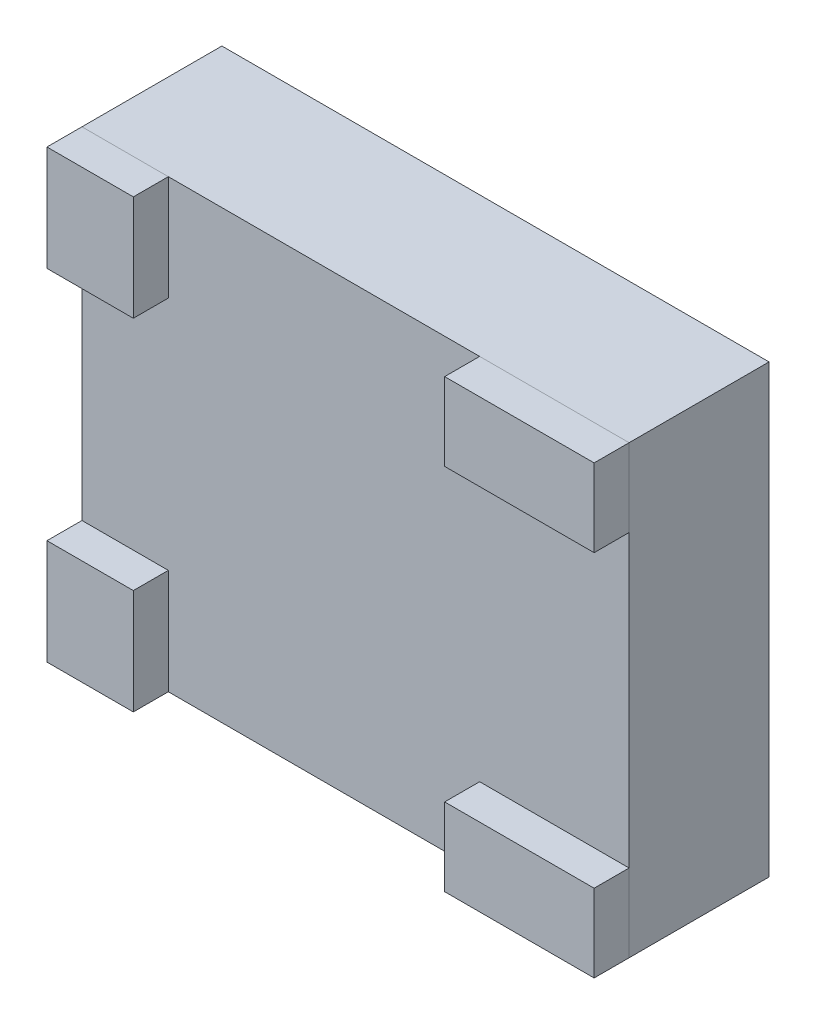
from build123d import *

# Parameters (mm, degrees)
ESBO_O1_W                  = 156.39786889
ESBO_O1_H                  = 127.51
NOVO_DEPTH                 = 40
ESBO_O2_W                  = 24.691065998
ESBO_O2_H                  = 30.055139327
RESSALTO_EXTRUS_O2_DEPTH   = 10
RESSALTO_EXTRUS_O2_2_DEPTH = 10
ESBO_O2_W_2                = 42.720162864
ESBO_O2_H_2                = 22.228889681
RESSALTO_EXTRUS_O2_3_DEPTH = 10
RESSALTO_EXTRUS_O2_4_DEPTH = 10


with BuildPart() as part:
    # Esboço1 → Novo (new body)
    with BuildSketch(Plane.XY):
        Rectangle(ESBO_O1_W, ESBO_O1_H)
    extrude(amount=NOVO_DEPTH)


with BuildPart() as body_2:
    # Esboço2 → Ressalto-extrusão2 (new body)
    with BuildSketch(Plane.XY.offset(40)):
        with Locations((-65.853401446, -48.727430337)):
            Rectangle(ESBO_O2_W, ESBO_O2_H)
    extrude(amount=RESSALTO_EXTRUS_O2_DEPTH)


with BuildPart() as body_3:
    # Esboço2 → Ressalto-extrus_o2 2 (new body)
    with BuildSketch(Plane.XY.offset(40)):
        with Locations((-65.853401446, 48.727430337)):
            Rectangle(ESBO_O2_W, ESBO_O2_H)
    extrude(amount=RESSALTO_EXTRUS_O2_2_DEPTH)


with BuildPart() as body_4:
    # Esboço2 → Ressalto-extrus_o2 3 (new body)
    with BuildSketch(Plane.XY.offset(40)):
        with Locations((56.838853013, 52.64055516)):
            Rectangle(ESBO_O2_W_2, ESBO_O2_H_2)
    extrude(amount=RESSALTO_EXTRUS_O2_3_DEPTH)


with BuildPart() as body_5:
    # Esboço2 → Ressalto-extrus_o2 4 (new body)
    with BuildSketch(Plane.XY.offset(40)):
        with Locations((56.838853013, -52.64055516)):
            Rectangle(ESBO_O2_W_2, ESBO_O2_H_2)
    extrude(amount=RESSALTO_EXTRUS_O2_4_DEPTH)


solid = Compound([part.part, body_2.part, body_3.part, body_4.part, body_5.part])
